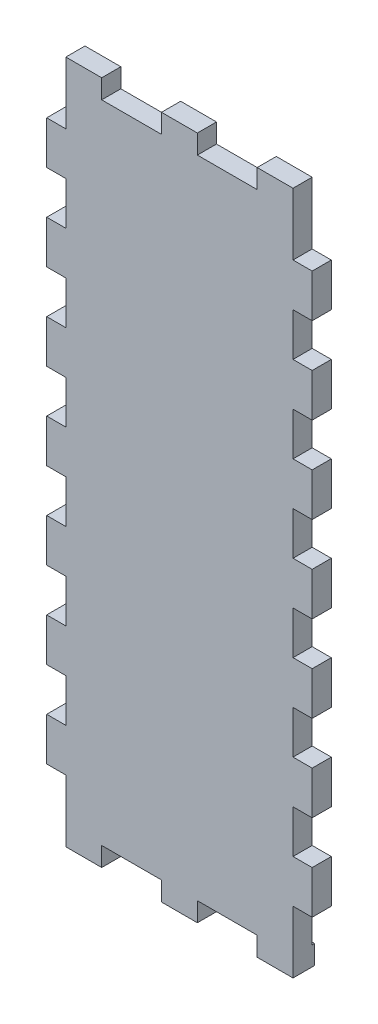
from build123d import *

# Parameters (mm, degrees)
SKETCH1_W           = 95
SKETCH1_H           = 270
BOSS_EXTRUDE1_DEPTH = 8
SKETCH2_W           = 15
SKETCH2_H           = 9
SKETCH2_H_2         = 8
BOSS_EXTRUDE2_DEPTH = 8
SKETCH4_W           = 8
SKETCH4_H           = 18
BOSS_EXTRUDE3_DEPTH = 8
SKETCH5_W           = 8
SKETCH5_H           = 18
BOSS_EXTRUDE4_DEPTH = 8
SKETCH6_W           = 15
SKETCH6_H           = 8
BOSS_EXTRUDE5_DEPTH = 8


with BuildPart() as part:
    # Sketch1 → Boss-Extrude1 (new body)
    with BuildSketch(Plane.XY):
        Rectangle(SKETCH1_W, SKETCH1_H)
    extrude(amount=BOSS_EXTRUDE1_DEPTH)

    # Sketch2 → Boss-Extrude2 (add)
    with BuildSketch(Plane.XZ.offset(135)):
        with Locations((-40, 3.5)):
            Rectangle(SKETCH2_W, SKETCH2_H)
        with Locations((0, 4)):
            Rectangle(SKETCH2_W, SKETCH2_H_2)
        with Locations((40, 3.5)):
            Rectangle(SKETCH2_W, SKETCH2_H)
    extrude(amount=BOSS_EXTRUDE2_DEPTH)

    # Sketch4 → Boss-Extrude3 (add)
    with BuildSketch(Plane(origin=(47.5, 0, 0), x_dir=(0, 0, -1), z_dir=(1, 0, 0))):
        with Locations((-4, 108)):
            Rectangle(SKETCH4_W, SKETCH4_H)
        with Locations((-4, 72)):
            Rectangle(SKETCH4_W, SKETCH4_H)
        with Locations((-4, 36)):
            Rectangle(SKETCH4_W, SKETCH4_H)
        with Locations((-4, 0)):
            Rectangle(SKETCH4_W, SKETCH4_H)
        with Locations((-4, -36)):
            Rectangle(SKETCH4_W, SKETCH4_H)
        with Locations((-4, -72)):
            Rectangle(SKETCH4_W, SKETCH4_H)
        with Locations((-4, -108)):
            Rectangle(SKETCH4_W, SKETCH4_H)
    extrude(amount=BOSS_EXTRUDE3_DEPTH)

    # Sketch5 → Boss-Extrude4 (add)
    with BuildSketch(Plane.ZY.offset(47.5)):
        with Locations((4, 108)):
            Rectangle(SKETCH5_W, SKETCH5_H)
        with Locations((4, 72)):
            Rectangle(SKETCH5_W, SKETCH5_H)
        with Locations((4, 36)):
            Rectangle(SKETCH5_W, SKETCH5_H)
        with Locations((4, 0)):
            Rectangle(SKETCH5_W, SKETCH5_H)
        with Locations((4, -36)):
            Rectangle(SKETCH5_W, SKETCH5_H)
        with Locations((4, -72)):
            Rectangle(SKETCH5_W, SKETCH5_H)
        with Locations((4, -108)):
            Rectangle(SKETCH5_W, SKETCH5_H)
    extrude(amount=BOSS_EXTRUDE4_DEPTH)

    # Sketch6 → Boss-Extrude5 (add)
    with BuildSketch(Plane(origin=(0, 135, 0), x_dir=(1, 0, 0), z_dir=(0, 1, 0))):
        with Locations((-40, -4)):
            Rectangle(SKETCH6_W, SKETCH6_H)
        with Locations((0, -4)):
            Rectangle(SKETCH6_W, SKETCH6_H)
        with Locations((40, -4)):
            Rectangle(SKETCH6_W, SKETCH6_H)
    extrude(amount=BOSS_EXTRUDE5_DEPTH)


solid = part.part
